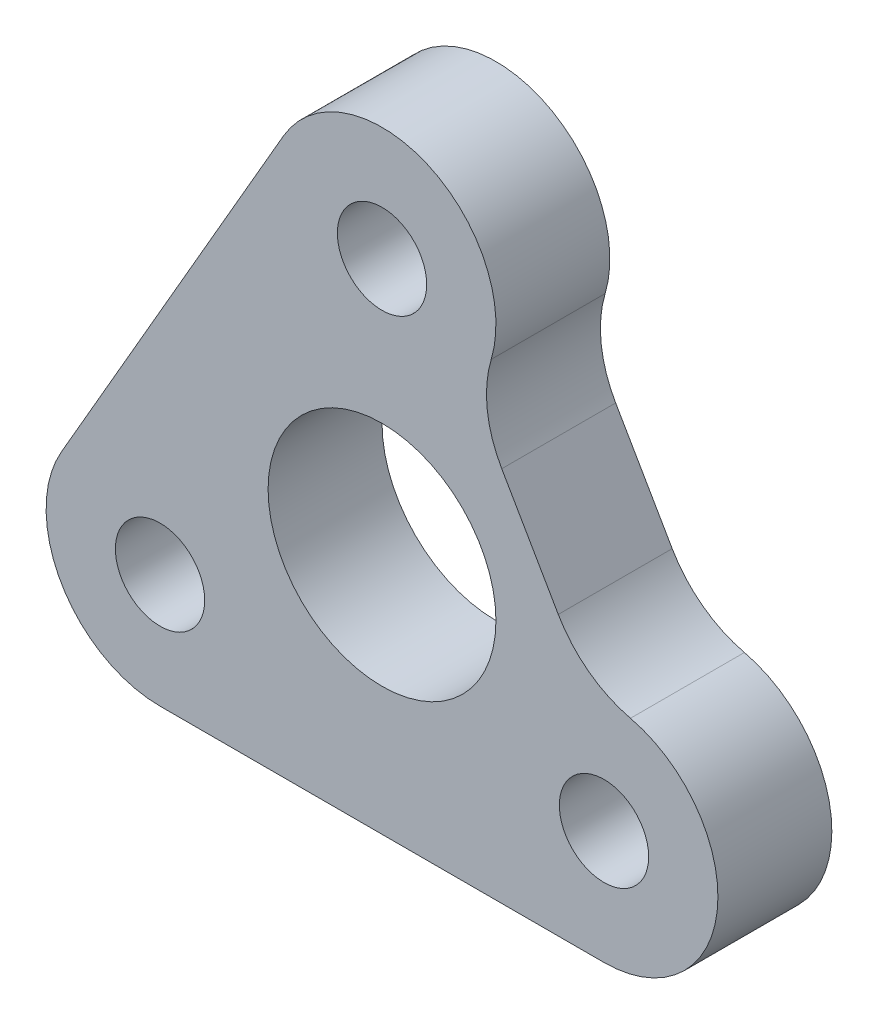
from build123d import *

# Parameters (mm, degrees)
SKETCH1_R           = 6.35
SKETCH1_R_2         = 2.4892
BOSS_EXTRUDE1_DEPTH = 6.35
FILLET1_R           = 6.35
CUT_EXTRUDE1_DEPTH  = 29.579578207
FILLET2_R           = 6.35


with BuildPart() as part:
    # Sketch1 → Boss-Extrude1 (new body)
    with BuildSketch(Plane.XY):
        Polygon((0, 26.9875), (23.371860585, -13.49375), (-23.371860585, -13.49375), align=None)
        Circle(SKETCH1_R, mode=Mode.SUBTRACT)
        with Locations((0, 14.2875)):
            Circle(SKETCH1_R_2, mode=Mode.SUBTRACT)
        with Locations((12.373337957, -7.14375)):
            Circle(SKETCH1_R_2, mode=Mode.SUBTRACT)
        with Locations((-12.373337957, -7.14375)):
            Circle(SKETCH1_R_2, mode=Mode.SUBTRACT)
    extrude(amount=BOSS_EXTRUDE1_DEPTH)

    # Fillet1
    fillet1_edges = [part.edges().sort_by_distance(p)[0] for p in [
        (23.371860585, -13.49375, 3.175),
        (-23.371860585, -13.49375, 3.175),
        (0, 26.9875, 3.175),
    ]]
    fillet(fillet1_edges, radius=FILLET1_R)

    # Sketch2 → Cut-Extrude1 (cut, through all)
    with BuildSketch(Plane.XY.offset(6.35)):
        with BuildLine():
            ThreePointArc((6.35, 14.2875), (6.00448145, 12.221416141), (5.005526767, 10.38017332))
            Line((5.005526767, 10.38017332), (11.492257175, -0.85517332))
            ThreePointArc((11.492257175, -0.85517332), (15.1582056, -1.436998542), (17.872599271, -3.96875))
            Line((17.872599271, -3.96875), (5.499261314, 17.4625))
            ThreePointArc((5.499261314, 17.4625), (6.133628997, 15.931000936), (6.35, 14.2875))
        make_face()
    extrude(amount=-CUT_EXTRUDE1_DEPTH, mode=Mode.SUBTRACT)

    # Fillet2
    fillet2_edges = [part.edges().sort_by_distance(p)[0] for p in [
        (11.492257175, -0.85517332, 3.175),
        (5.005526767, 10.38017332, 3.175),
    ]]
    fillet(fillet2_edges, radius=FILLET2_R)


solid = part.part
